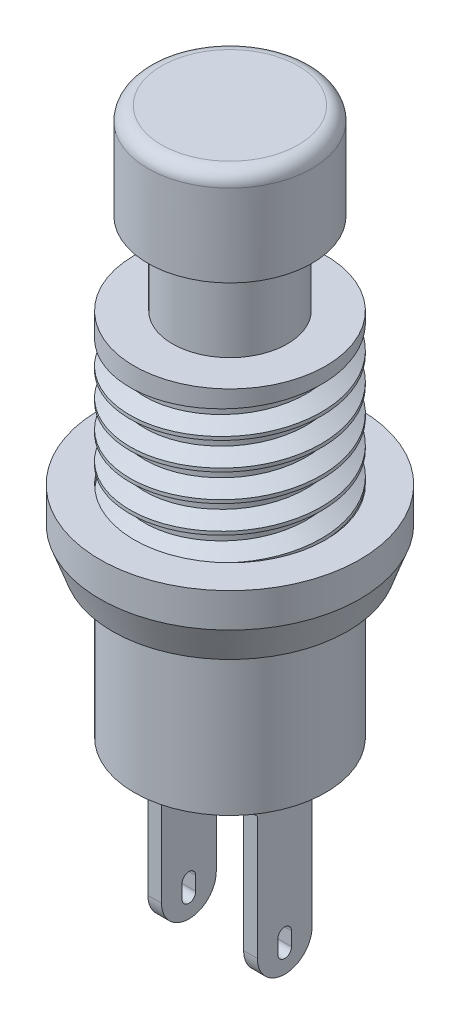
from build123d import *
from build123d.topology import SkipClean

# Parameters (mm, degrees)
FILLET_1_R          = 0.5
THREAD_1_PITCH      = 1
SKETCH_7_W          = 0.5
SKETCH_7_H          = 4
EXTRUDE_1_DEPTH     = 6.5
CUT_EXTRUDE_START   = -4
CUT_EXTRUDE_1_DEPTH = 4


# Read off the part's stored shape, not the designer's step: Вырез-Вытянуть1
with BuildPart() as part:
    # Sketch 1 → Повернуть1 (revolve)
    with BuildSketch(Plane.XY, mode=Mode.PRIVATE) as revolve_1_sk:
        Polygon((0, 14.5), (3, 14.5), (3, 11), (2.1, 11), (2.1, 8), (3.5, 8), (3.5, 2.5), (4.75, 2.5), (4.75, 1.25), (4.295037207, 0), (3.5, 0), (3.5, -5.5), (0, -5.5), align=None)
    revolve(revolve_1_sk.sketch.rotate(Axis((0, -263.768478863, 0), (0, 1, 0)), 90), axis=Axis((0, -263.768478863, 0), (0, 1, 0)))

    # Скругление1
    fillet_1_edges = [part.edges().sort_by_distance(p)[0] for p in [
        (0, 14.5, 3),
    ]]
    fillet(fillet_1_edges, radius=FILLET_1_R)

    # Резьба1: the profile of Sketch 1 2 profile screwed along a right-hand helix of 5.5 turns, 8 arcs to a turn; built about Z, then put on its axis
    with SkipClean():  # the faces are left unmerged after this step: merging them gives an invalid solid
        thread_1_z = Axis((0, 0, 0), (0, 0, 1))
        thread_1_corners = [(3.5003, 0, -0.000173205), (3.5003, 0, 0.875173202), (2.958734125, 0, 0.562499999), (2.958734125, 0, 0.312499999)]
        with BuildLine(mode=Mode.PRIVATE) as thread_1_profile:
            Line(thread_1_corners[0], thread_1_corners[1])
            Line(thread_1_corners[1], thread_1_corners[2])
            Line(thread_1_corners[2], thread_1_corners[3])
            Line(thread_1_corners[3], thread_1_corners[0])
        thread_1_cap = Face(thread_1_profile.wire())
        thread_1_turn_angles = [0, 22.5, 45, 67.5, 90, 112.5, 135, 157.5, 180, 202.5, 225, 247.5, 270, 292.5, 315, 337.5, 360]
        thread_1_turn_weights = [1, 0.9238795325112867, 1, 0.9238795325112867, 1, 0.9238795325112867, 1, 0.9238795325112867, 1, 0.9238795325112867, 1, 0.9238795325112867, 1, 0.9238795325112867, 1, 0.9238795325112867, 1]
        thread_1_turn_rails = [Edge.make_bspline([Vector(p[0], p[1], 0).rotate(thread_1_z, thread_1_turn_angles[k]) / thread_1_turn_weights[k] + Vector(0, 0, p[2] + THREAD_1_PITCH * thread_1_turn_angles[k] / 360) for k in range(17)], [0, 0, 0, 1, 1, 2, 2, 3, 3, 4, 4, 5, 5, 6, 6, 7, 7, 8, 8, 8], 2, thread_1_turn_weights) for p in thread_1_corners]
        thread_1_turn_sides = [Face.make_surface_from_curves(thread_1_turn_rails[p[0]], thread_1_turn_rails[p[1]]) for p in [(0, 1), (1, 2), (2, 3), (3, 0)]]
        thread_1_last_angles = [1800, 1822.5, 1845, 1867.5, 1890, 1912.5, 1935, 1957.5, 1980]
        thread_1_last_weights = [1, 0.9238795325112867, 1, 0.9238795325112867, 1, 0.9238795325112867, 1, 0.9238795325112792, 1]
        thread_1_last_rails = [Edge.make_bspline([Vector(p[0], p[1], 0).rotate(thread_1_z, thread_1_last_angles[k]) / thread_1_last_weights[k] + Vector(0, 0, p[2] + THREAD_1_PITCH * thread_1_last_angles[k] / 360) for k in range(9)], [0, 0, 0, 1, 1, 2, 2, 3, 3, 4, 4, 4], 2, thread_1_last_weights) for p in thread_1_corners]
        thread_1_last_sides = [Face.make_surface_from_curves(thread_1_last_rails[p[0]], thread_1_last_rails[p[1]]) for p in [(0, 1), (1, 2), (2, 3), (3, 0)]]
        thread_1 = Plane(origin=(0, 8, 0), x_dir=(-1, 0, 0), z_dir=(0, -1, 0)) * Solid(Shell([*[p.moved(Location((0, 0, THREAD_1_PITCH * i))) for i in range(5) for p in thread_1_turn_sides], *thread_1_last_sides, thread_1_cap, thread_1_cap.rotate(thread_1_z, 1980).moved(Location((0, 0, THREAD_1_PITCH * 1980 / 360)))]))
        add(thread_1, mode=Mode.SUBTRACT)

    # Эскиз7 → Бобышка-Вытянуть1 (add)
    with SkipClean():  # the faces are left unmerged after this step: merging them gives an invalid solid
        with BuildSketch(Plane.XZ.offset(5.5)):
            with Locations((1.75, 0)):
                Rectangle(SKETCH_7_W, SKETCH_7_H)
            with Locations((-1.75, 0)):
                Rectangle(SKETCH_7_W, SKETCH_7_H)
        extrude(amount=EXTRUDE_1_DEPTH)

    # Вырез-Вытянуть1 outline → Вырез-Вытянуть1 (cut)
    with SkipClean():  # the faces are left unmerged after this step: merging them gives an invalid solid
        with BuildSketch(Plane.ZY.offset(2).offset(CUT_EXTRUDE_START)):
            with BuildLine():
                Line((-2, -12), (-0.04936258, -12))
                Line((-0.04936258, -12), (-0.04936258, -11.998780925))
                ThreePointArc((-0.04936258, -11.998780925), (-0.724348873, -11.689433615), (-1, -11))
                Line((-1, -11), (-1, -6.5))
                Line((-1, -6.5), (-2, -5.5))
                Line((-2, -5.5), (-2, -12))
            make_face()
            with BuildLine():
                Line((0.042087064, -11.999113947), (0.042087064, -12))
                Line((0.042087064, -12), (2, -12))
                Line((2, -12), (2, -5.5))
                Line((2, -5.5), (1, -6.5))
                Line((1, -6.5), (1, -11))
                ThreePointArc((1, -11), (0.721833452, -11.692066809), (0.042087064, -11.999113947))
            make_face()
            with BuildLine():
                ThreePointArc((-0.25, -11.25), (0, -11.5), (0.25, -11.25))
                Line((0.25, -11.25), (0.25, -10.75))
                ThreePointArc((0.25, -10.75), (0, -10.5), (-0.25, -10.75))
                Line((-0.25, -10.75), (-0.25, -11.25))
            make_face()
        extrude(amount=CUT_EXTRUDE_1_DEPTH, mode=Mode.SUBTRACT)


solid = part.part
